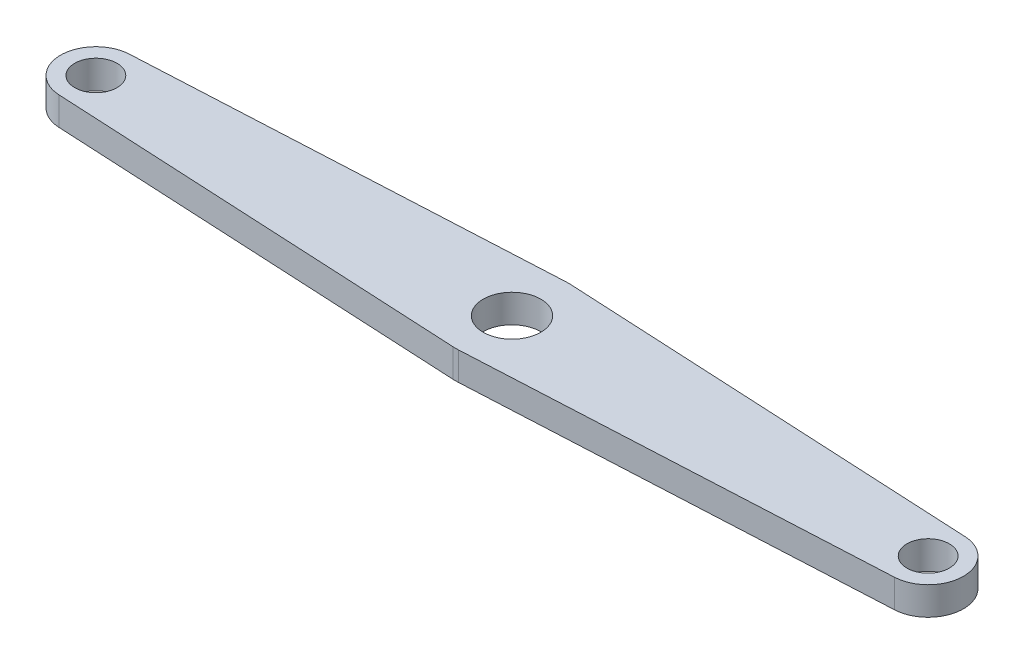
from build123d import *

# Parameters (mm, degrees)
CROQUIS1_R                 = 10.2
SALIENTE_EXTRUIR1_DEPTH    = 5
CORTAR_EXTRUIR2_DEPTH      = 162.322658049
CORTAR_EXTRUIR2_DEPTH_BACK = 162.322658049
CROQUIS3_R                 = 7.5


with BuildPart() as part:
    # Croquis1 → Saliente-Extruir1 (new, symmetric)
    with BuildSketch(Plane(origin=(0, 0, 0), x_dir=(1, 0, 0), z_dir=(0, 1, 0))):
        with BuildLine():
            Line((-148.13559322, 12.483830392), (-1.016949153, 19.974128627))
            ThreePointArc((-1.016949153, 19.974128627), (0, 20), (1.016949153, 19.974128627))
            Line((1.016949153, 19.974128627), (148.13559322, 12.483830392))
            ThreePointArc((148.13559322, 12.483830392), (160, 0), (148.13559322, -12.483830392))
            Line((148.13559322, -12.483830392), (1.016949153, -19.974128627))
            ThreePointArc((1.016949153, -19.974128627), (0, -20), (-1.016949153, -19.974128627))
            Line((-1.016949153, -19.974128627), (-148.13559322, -12.483830392))
            ThreePointArc((-148.13559322, -12.483830392), (-160, 0), (-148.13559322, 12.483830392))
        make_face()
        Circle(CROQUIS1_R, mode=Mode.SUBTRACT)
    extrude(amount=SALIENTE_EXTRUIR1_DEPTH, both=True)

    # Croquis3 → Cortar-Extruir2 (cut, two sides: drawn at the far end of the back side and taken through both)
    with BuildSketch(Plane(origin=(0, 0, 0), x_dir=(1, 0, 0), z_dir=(0, 1, 0)).offset(-CORTAR_EXTRUIR2_DEPTH_BACK)):
        with Locations((-147.5, 0)):
            Circle(CROQUIS3_R)
        with Locations((147.5, 0)):
            Circle(CROQUIS3_R)
    extrude(amount=CORTAR_EXTRUIR2_DEPTH + CORTAR_EXTRUIR2_DEPTH_BACK, mode=Mode.SUBTRACT)


solid = part.part
